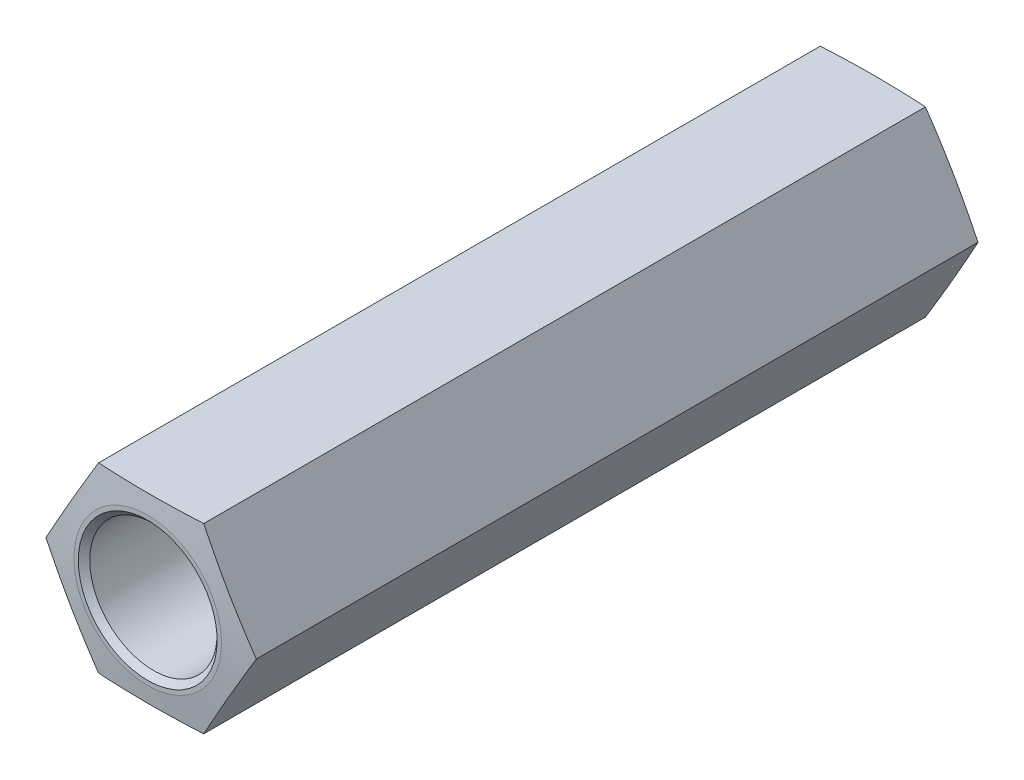
from build123d import *

# Parameters (mm, degrees)
SKETCH1_R      = 2.220000009
EXTRUDE1_DEPTH = 12.7
CHAMFER1_SIZE  = 0.2


with BuildPart() as part:
    # Sketch1 → Extrude1 (new, symmetric)
    with BuildSketch(Plane.XY):
        Polygon((-3.666174209, -6.3e-08), (-1.833087105, -3.175000063), (1.833087105, -3.174999937), (3.666174209, 6.3e-08), (1.833087105, 3.175000063), (-1.833087105, 3.174999937), align=None)
        with Locations((0, -6.3e-08)):
            Circle(SKETCH1_R, mode=Mode.SUBTRACT)
    extrude(amount=EXTRUDE1_DEPTH, both=True)

    # Chamfer1
    chamfer1_edges = [part.edges().sort_by_distance(p)[0] for p in [
        (-2.220000009, -6.3e-08, -12.7),
        (-2.220000009, -6.3e-08, 12.7),
    ]]
    chamfer(chamfer1_edges, length=CHAMFER1_SIZE)

    # Sketch2 → Cut-Revolve1 (revolve, cut)
    with BuildSketch(Plane.XZ):
        Polygon((-2.572739255, -12.7), (-3.666174209, -12.58), (-3.666174209, -12.7), align=None)
    cut_revolve1 = revolve(axis=Axis((0, -6.3e-08, 12.7), (0, 0, -1)), mode=Mode.SUBTRACT)

    # Mirror1: Cut-Revolve1 across plane
    add(cut_revolve1.mirror(Plane.XY), mode=Mode.SUBTRACT)


solid = part.part
